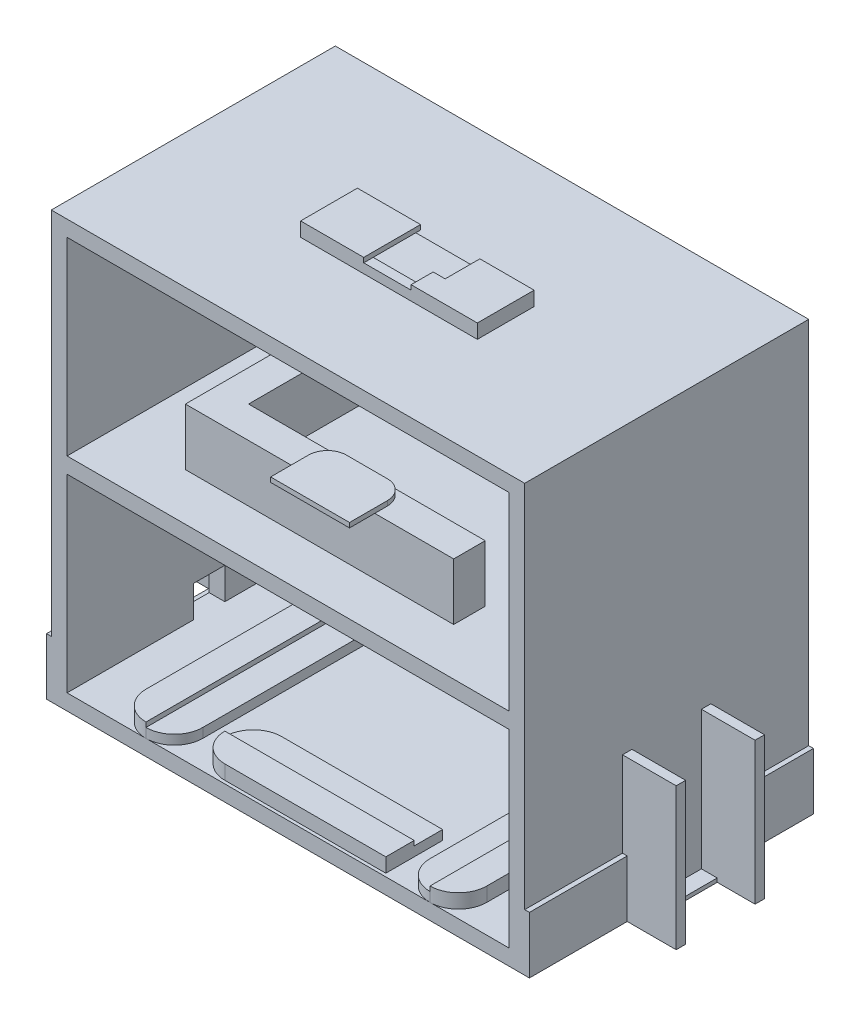
from build123d import *

# Parameters (mm, degrees)
SKETCH1_W            = 150
SKETCH1_H            = 90
BOSS_EXTRUDE1_DEPTH  = 135
SKETCH2_W            = 140
SKETCH2_H            = 60
CUT_EXTRUDE1_DEPTH   = 135
SKETCH3_W            = 3
SKETCH3_H            = 45
BOSS_EXTRUDE2_DEPTH  = 17
SKETCH4_W            = 22
SKETCH4_H            = 5
BOSS_EXTRUDE3_DEPTH  = 7
MIRROR2_OUTLINE_W    = 7
MIRROR2_OUTLINE_H    = 22
MIRROR2_DEPTH        = 5
SKETCH5_W            = 10
SKETCH5_H            = 10
CUT_EXTRUDE3_DEPTH   = 220.406016326
SKETCH6_W            = 56
SKETCH6_H            = 18
BOSS_EXTRUDE4_DEPTH  = 1.5
SKETCH7_W            = 18
SKETCH7_H            = 90
BOSS_EXTRUDE5_DEPTH  = 3
FILLET1_R            = 9
BOSS_EXTRUDE6_DEPTH  = 1.5
SKETCH11_W           = 60
SKETCH11_H           = 18
BOSS_EXTRUDE7_DEPTH  = 3
FILLET2_R            = 9
BOSS_EXTRUDE8_DEPTH  = 1.5
BOSS_EXTRUDE9_DEPTH  = 18
SKETCH15_W           = 25
SKETCH15_H           = 18
BOSS_EXTRUDE10_DEPTH = 1.5
FILLET3_R            = 6
SKETCH16_W           = 21
SKETCH16_H           = 3
BOSS_EXTRUDE11_DEPTH = 1.5
SKETCH17_W           = 3.8
SKETCH17_H           = 4
SKETCH17_H_2         = 3
SKETCH17_W_2         = 2
SKETCH17_H_3         = 15
BOSS_EXTRUDE13_DEPTH = 1.5
SKETCH18_W           = 31
SKETCH18_H           = 18
BOSS_EXTRUDE14_DEPTH = 1.5
SKETCH19_W           = 22
SKETCH19_H           = 5
CUT_EXTRUDE4_DEPTH   = 14
SKETCH20_W           = 22
SKETCH20_H           = 5
CUT_EXTRUDE5_DEPTH   = 7
SKETCH21_W           = 22
SKETCH21_H           = 1.2
BOSS_EXTRUDE15_DEPTH = 5


# Read off the part's stored shape, not the designer's step: Mirror2
with BuildPart() as part:
    # Sketch1 → Boss-Extrude1 (new body)
    with BuildSketch(Plane(origin=(0, 0, 0), x_dir=(1, 0, 0), z_dir=(0, 1, 0))):
        Rectangle(SKETCH1_W, SKETCH1_H)
    extrude(amount=BOSS_EXTRUDE1_DEPTH)

    # Sketch2 → Cut-Extrude1 (cut)
    with BuildSketch(Plane.XY.offset(45)):
        with Locations((0, 35)):
            Rectangle(SKETCH2_W, SKETCH2_H)
        with Locations((0, 100)):
            Rectangle(SKETCH2_W, SKETCH2_H)
    extrude(amount=-CUT_EXTRUDE1_DEPTH, mode=Mode.SUBTRACT)

    # Sketch3 → Boss-Extrude2 (add)
    with BuildSketch(Plane(origin=(75, 0, 0), x_dir=(0, 0, -1), z_dir=(1, 0, 0))):
        with Locations((12.5, 22.5)):
            Rectangle(SKETCH3_W, SKETCH3_H)
        with Locations((-12.5, 22.5)):
            Rectangle(SKETCH3_W, SKETCH3_H)
    boss_extrude2 = extrude(amount=BOSS_EXTRUDE2_DEPTH)

    # Mirror1: Boss-Extrude2 across plane
    add(boss_extrude2.mirror(Plane(origin=(0, 0, 0), x_dir=(0, 0, 1), z_dir=(1, 0, 0))))

    # Sketch4 → Boss-Extrude3 (add)
    with BuildSketch(Plane.ZY.offset(75)):
        with Locations((0, 2.5)):
            Rectangle(SKETCH4_W, SKETCH4_H)
    extrude(amount=BOSS_EXTRUDE3_DEPTH)

    # Mirror2 outline → Mirror2 (add)
    with BuildSketch(Plane(origin=(0, 0, 0), x_dir=(1, 0, 0), z_dir=(0, 1, 0))):
        with Locations((-85.5, 0)):
            Rectangle(MIRROR2_OUTLINE_W, MIRROR2_OUTLINE_H)
        with Locations((78.5, 0)):
            Rectangle(MIRROR2_OUTLINE_W, MIRROR2_OUTLINE_H)
    extrude(amount=MIRROR2_DEPTH)

    # Sketch5 → Cut-Extrude3 (cut, through all)
    with BuildSketch(Plane.ZY.offset(75)):
        with Locations((0, 10)):
            Rectangle(SKETCH5_W, SKETCH5_H)
    extrude(amount=-CUT_EXTRUDE3_DEPTH, mode=Mode.SUBTRACT)

    # Sketch6 → Boss-Extrude4 (add)
    with BuildSketch(Plane(origin=(0, 135, 0), x_dir=(1, 0, 0), z_dir=(0, 1, 0))):
        with Locations((0, -4)):
            Rectangle(SKETCH6_W, SKETCH6_H)
    extrude(amount=BOSS_EXTRUDE4_DEPTH)

    # Sketch7 → Boss-Extrude5 (add)
    with BuildSketch(Plane(origin=(0, 5, 0), x_dir=(1, 0, 0), z_dir=(0, 1, 0))):
        with Locations((45, 0)):
            Rectangle(SKETCH7_W, SKETCH7_H)
        with Locations((-45, 0)):
            Rectangle(SKETCH7_W, SKETCH7_H)
    extrude(amount=BOSS_EXTRUDE5_DEPTH)

    # Fillet1
    fillet1_edges = [part.edges().sort_by_distance(p)[0] for p in [
        (36, 6.5, 45),
        (54, 6.5, 45),
        (-36, 6.5, 45),
        (-54, 6.5, 45),
        (-54, 6.5, -45),
        (-36, 6.5, -45),
        (54, 6.5, -45),
        (36, 6.5, -45),
    ]]
    fillet(fillet1_edges, radius=FILLET1_R - 0.0001)  # a hair under: the kernel refuses the full size

    # Sketch10 → Boss-Extrude6 (add)
    with BuildSketch(Plane(origin=(0, 8, 0), x_dir=(1, 0, 0), z_dir=(0, 1, 0))):
        with BuildLine():
            Line((-45, 45), (-45, -45))
            ThreePointArc((-45, -45), (-51.363961031, -42.363961031), (-54, -36))
            Line((-54, -36), (-54, 36))
            ThreePointArc((-54, 36), (-51.363961031, 42.363961031), (-45, 45))
        make_face()
        with BuildLine():
            Line((45, 45), (45, -45))
            ThreePointArc((45, -45), (51.363961031, -42.363961031), (54, -36))
            Line((54, -36), (54, 36))
            ThreePointArc((54, 36), (51.363961031, 42.363961031), (45, 45))
        make_face()
    extrude(amount=BOSS_EXTRUDE6_DEPTH)

    # Sketch11 → Boss-Extrude7 (add)
    with BuildSketch(Plane(origin=(0, 5, 0), x_dir=(1, 0, 0), z_dir=(0, 1, 0))):
        with Locations((0, 35)):
            Rectangle(SKETCH11_W, SKETCH11_H)
        with Locations((0, -35)):
            Rectangle(SKETCH11_W, SKETCH11_H)
    extrude(amount=BOSS_EXTRUDE7_DEPTH)

    # Fillet2
    fillet2_edges = [part.edges().sort_by_distance(p)[0] for p in [
        (30, 6.5, -26),
        (30, 6.5, -44),
        (-30, 6.5, 26),
        (-30, 6.5, 44),
    ]]
    fillet(fillet2_edges, radius=FILLET2_R - 0.0001)  # a hair under: the kernel refuses the full size

    # Sketch13 → Boss-Extrude8 (add)
    with BuildSketch(Plane(origin=(0, 8, 0), x_dir=(1, 0, 0), z_dir=(0, 1, 0))):
        with BuildLine():
            Line((21, 44), (-30, 44))
            Line((-30, 44), (-30, 35))
            Line((-30, 35), (30, 35))
            ThreePointArc((30, 35), (27.363961031, 41.363961031), (21, 44))
        make_face()
        with BuildLine():
            Line((-21, -44), (30, -44))
            Line((30, -44), (30, -35))
            Line((30, -35), (-30, -35))
            ThreePointArc((-30, -35), (-27.363961031, -41.363961031), (-21, -44))
        make_face()
    extrude(amount=BOSS_EXTRUDE8_DEPTH)

    # Sketch14 → Boss-Extrude9 (add)
    with BuildSketch(Plane(origin=(0, 70, 0), x_dir=(1, 0, 0), z_dir=(0, 1, 0))):
        Polygon((-47.5, -30), (37.5, -30), (37.5, -20), (-37.5, -20), (-37.5, 20), (37.5, 20), (37.5, 30), (-47.5, 30), align=None)
    extrude(amount=BOSS_EXTRUDE9_DEPTH)

    # Sketch15 → Boss-Extrude10 (add)
    with BuildSketch(Plane(origin=(0, 88, 0), x_dir=(1, 0, 0), z_dir=(0, 1, 0))):
        with Locations((0, -29)):
            Rectangle(SKETCH15_W, SKETCH15_H)
        with Locations((0, 29)):
            Rectangle(SKETCH15_W, SKETCH15_H)
    extrude(amount=BOSS_EXTRUDE10_DEPTH)

    # Fillet3
    fillet3_edges = [part.edges().sort_by_distance(p)[0] for p in [
        (-12.5, 88.75, 20),
        (12.5, 88.75, 20),
        (-12.5, 88.75, -20),
        (12.5, 88.75, -20),
    ]]
    fillet(fillet3_edges, radius=FILLET3_R)

    # Sketch16 → Boss-Extrude11 (add)
    with BuildSketch(Plane(origin=(0, 136.5, 0), x_dir=(1, 0, 0), z_dir=(0, 1, 0))):
        Polygon((-10, 5), (-28, 5), (-28, -13), (-10, -13), (-10, -10), align=None)
        with Locations((0.5, -11.5)):
            Rectangle(SKETCH16_W, SKETCH16_H)
        Polygon((28, 5), (11, 5), (11, -10), (11, -13), (28, -13), align=None)
    extrude(amount=BOSS_EXTRUDE11_DEPTH)

    # Sketch17 → Boss-Extrude13 (add)
    with BuildSketch(Plane(origin=(0, 138, 0), x_dir=(1, 0, 0), z_dir=(0, 1, 0))):
        Polygon((10.8, -6), (10.8, -10), (11, -10), (11, 5), (10.8, 5), align=None)
        Polygon((10.8, -10), (10.8, -13), (28, -13), (28, 5), (11, 5), (11, -10), align=None)
        with Locations((8.9, -8)):
            Rectangle(SKETCH17_W, SKETCH17_H)
        with Locations((8.9, -11.5)):
            Rectangle(SKETCH17_W, SKETCH17_H_2)
        Polygon((-10, 5), (-28, 5), (-28, -13), (-8, -13), (-8, -10), (-10, -10), align=None)
        with Locations((-9, -2.5)):
            Rectangle(SKETCH17_W_2, SKETCH17_H_3)
    extrude(amount=BOSS_EXTRUDE13_DEPTH)

    # Sketch18 → Boss-Extrude14 (add)
    with BuildSketch(Plane.ZY.offset(75)):
        with Locations((29.5, 9)):
            Rectangle(SKETCH18_W, SKETCH18_H)
        with Locations((-29.5, 9)):
            Rectangle(SKETCH18_W, SKETCH18_H)
    boss_extrude14 = extrude(amount=BOSS_EXTRUDE14_DEPTH)

    # Mirror3: Boss-Extrude14 across plane
    add(boss_extrude14.mirror(Plane(origin=(0, 0, 0), x_dir=(0, 0, 1), z_dir=(1, 0, 0))))

    # Sketch19 → Cut-Extrude4 (cut)
    with BuildSketch(Plane.ZY.offset(89)):
        with Locations((0, 2.5)):
            Rectangle(SKETCH19_W, SKETCH19_H)
    extrude(amount=-CUT_EXTRUDE4_DEPTH, mode=Mode.SUBTRACT)

    # Sketch20 → Cut-Extrude5 (cut)
    with BuildSketch(Plane(origin=(82, 0, 0), x_dir=(0, 0, -1), z_dir=(1, 0, 0))):
        with Locations((0, 2.5)):
            Rectangle(SKETCH20_W, SKETCH20_H)
    extrude(amount=-CUT_EXTRUDE5_DEPTH, mode=Mode.SUBTRACT)

    # Sketch21 → Boss-Extrude15 (add)
    with BuildSketch(Plane(origin=(75, 0, 0), x_dir=(0, 0, -1), z_dir=(1, 0, 0))):
        with Locations((0, 0.6)):
            Rectangle(SKETCH21_W, SKETCH21_H)
    boss_extrude15 = extrude(amount=BOSS_EXTRUDE15_DEPTH)

    # Mirror4: Boss-Extrude15 across plane
    add(boss_extrude15.mirror(Plane(origin=(0, 0, 0), x_dir=(0, 0, 1), z_dir=(1, 0, 0))))


solid = part.part
